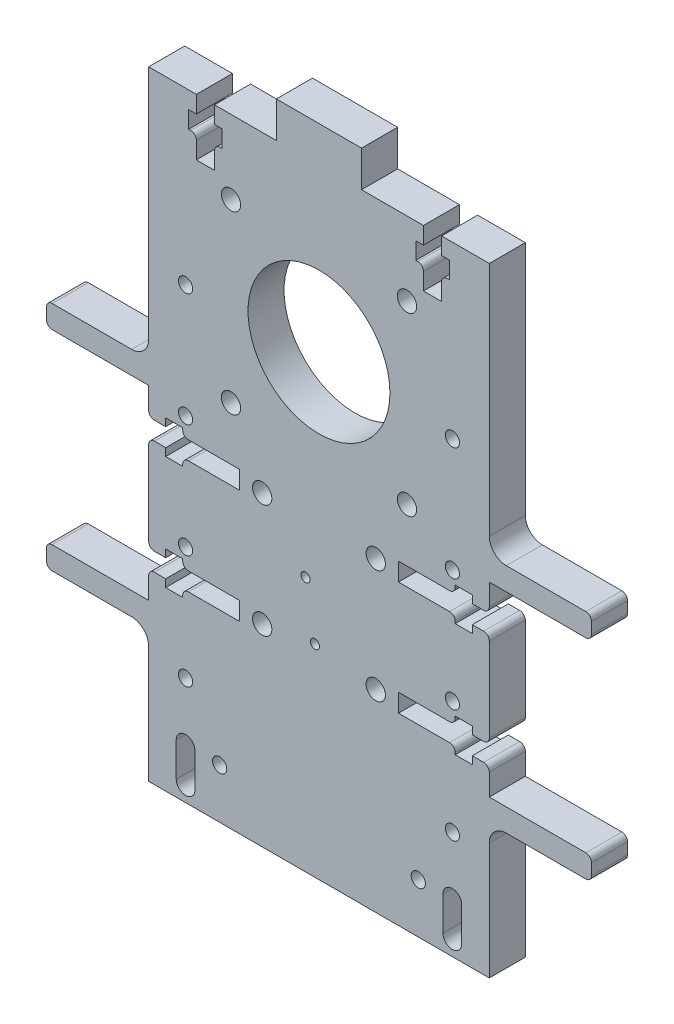
from build123d import *

# Parameters (mm, degrees)
BOSS_EXTRUDE1_DEPTH        = 6.35
FILLET1_R                  = 1
FILLET3_R                  = 3
M2_TAPPED_HOLE1_D          = 1.6
M2_TAPPED_HOLE2_D          = 1.6
M3_CLEARANCE_HOLE1_D       = 3.4
M3_CLEARANCE_HOLE2_D       = 3.4
M3_CLEARANCE_HOLE3_D       = 3.4
M3_CLEARANCE_HOLE4_D       = 3.4
M3_TAPPED_HOLE2_D          = 2.5
M3_TAPPED_HOLE3_D          = 2.5
M3_TAPPED_HOLE4_D          = 2.5
M3_TAPPED_HOLE5_D          = 2.5
M3_TAPPED_HOLE6_D          = 2.5
M3_TAPPED_HOLE7_D          = 2.5
M3_TAPPED_HOLE8_D          = 2.5
M3_TAPPED_HOLE9_D          = 2.5
M3_TAPPED_HOLE10_D         = 2.5
M3_CLEARANCE_HOLE8_D       = 3.4
M3_CLEARANCE_HOLE7_D       = 3.4
M3_TAPPED_HOLE1_D          = 2.5
M3_CLEARANCE_HOLE6_D       = 3.4
F_25_0_25_DIAMETER_HOLE1_D = 25
M3_CLEARANCE_HOLE5_D       = 3.4
FILLET4_R                  = 1


with BuildPart() as part:
    # Sketch1 → Boss-Extrude1 (new body)
    with BuildSketch(Plane.XY.offset(6.35)):
        Polygon((48, -56.9), (48, -52.9), (30, -52.9), (30, -48.1), (27, -48.1), (27, -49.45), (24, -49.45), (24, -48.1), (14, -48.1), (14, -44.9), (24, -44.9), (24, -43.55), (27, -43.55), (27, -44.9), (30, -44.9), (30, -28.1), (27, -28.1), (27, -29.45), (24, -29.45), (24, -28.1), (14, -28.1), (14, -24.9), (24, -24.9), (24, -23.55), (27, -23.55), (27, -24.9), (30, -24.9), (30, -20.1), (48, -20.1), (48, -16.1), (30, -16.1), (30, 28.5), (21.6, 28.5), (21.6, 25.5), (22.95, 25.5), (22.95, 22.5), (21.6, 22.5), (21.6, 18.5), (18.4, 18.5), (18.4, 22.5), (17.05, 22.5), (17.05, 25.5), (18.4, 25.5), (18.4, 28.5), (7.5, 28.5), (7.5, 34.85), (-7.5, 34.85), (-7.5, 28.5), (-18.4, 28.5), (-18.4, 25.5), (-17.05, 25.5), (-17.05, 22.5), (-18.4, 22.5), (-18.4, 18.5), (-21.6, 18.5), (-21.6, 22.5), (-22.95, 22.5), (-22.95, 25.5), (-21.6, 25.5), (-21.6, 28.5), (-30, 28.5), (-30, -16.1), (-48, -16.1), (-48, -20.1), (-30, -20.1), (-30, -24.9), (-27, -24.9), (-27, -23.55), (-24, -23.55), (-24, -24.9), (-14, -24.9), (-14, -28.1), (-24, -28.1), (-24, -29.45), (-27, -29.45), (-27, -28.1), (-30, -28.1), (-30, -44.9), (-27, -44.9), (-27, -43.55), (-24, -43.55), (-24, -44.9), (-14, -44.9), (-14, -48.1), (-24, -48.1), (-24, -49.45), (-27, -49.45), (-27, -48.1), (-30, -48.1), (-30, -52.9), (-48, -52.9), (-48, -56.9), (-30, -56.9), (-30, -80.5), (30, -80.5), (30, -56.9), align=None)
        with BuildLine():
            Line((-21.842448699, -71.75), (-21.842448699, -77.75))
            ThreePointArc((-21.842448699, -77.75), (-23.492448699, -79.4), (-25.142448699, -77.75))
            Line((-25.142448699, -77.75), (-25.142448699, -71.75))
            ThreePointArc((-25.142448699, -71.75), (-23.492448699, -70.1), (-21.842448699, -71.75))
        make_face(mode=Mode.SUBTRACT)
        with BuildLine():
            Line((21.842448699, -77.75), (21.842448699, -71.75))
            ThreePointArc((21.842448699, -71.75), (23.492448699, -70.1), (25.142448699, -71.75))
            Line((25.142448699, -71.75), (25.142448699, -77.75))
            ThreePointArc((25.142448699, -77.75), (23.492448699, -79.4), (21.842448699, -77.75))
        make_face(mode=Mode.SUBTRACT)
    extrude(amount=-BOSS_EXTRUDE1_DEPTH)

    # Fillet1
    fillet1_edges = [part.edges().sort_by_distance(p)[0] for p in [
        (-48, -16.1, 3.175),
        (48, -16.1, 3.175),
        (48, -56.9, 3.175),
        (30, -24.9, 3.175),
        (-30, -44.9, 3.175),
        (30, -28.1, 3.175),
        (-30, -24.9, 3.175),
        (30, -44.9, 3.175),
        (-30, -48.1, 3.175),
        (30, -48.1, 3.175),
        (-30, -28.1, 3.175),
        (-24, -48.1, 3.175),
        (-24, -44.9, 3.175),
        (-24, -28.1, 3.175),
        (-24, -24.9, 3.175),
        (24, -28.1, 3.175),
        (24, -24.9, 3.175),
        (24, -48.1, 3.175),
        (24, -44.9, 3.175),
        (48, -52.9, 3.175),
        (48, -20.1, 3.175),
        (-48, -56.9, 3.175),
        (-48, -52.9, 3.175),
        (-48, -20.1, 3.175),
    ]]
    fillet(fillet1_edges, radius=FILLET1_R)

    # Fillet3
    fillet3_edges = [part.edges().sort_by_distance(p)[0] for p in [
        (-30, -16.1, 3.175),
        (30, -16.1, 3.175),
        (-30, -56.9, 3.175),
        (30, -56.9, 3.175),
    ]]
    fillet(fillet3_edges, radius=FILLET3_R)

    # M2 Tapped Hole1 (through all)
    with Locations(Plane.XY.offset(6.35)):
        with Locations((-2.359287388, -35.545092005)):
            Hole(M2_TAPPED_HOLE1_D / 2)

    # M2 Tapped Hole2 (through all)
    with Locations(Plane.XY.offset(6.35)):
        with Locations((-0.7096297, -44.900765659)):
            Hole(M2_TAPPED_HOLE2_D / 2)

    # M3 Clearance Hole1 (through all)
    with Locations(Plane.XY.offset(6.35)):
        with Locations((15.5, 15.5)):
            Hole(M3_CLEARANCE_HOLE1_D / 2)

    # M3 Clearance Hole2 (through all)
    with Locations(Plane.XY.offset(6.35)):
        with Locations((-15.5, -15.5)):
            Hole(M3_CLEARANCE_HOLE2_D / 2)

    # M3 Clearance Hole3 (through all)
    with Locations(Plane.XY.offset(6.35)):
        with Locations((15.5, -15.5)):
            Hole(M3_CLEARANCE_HOLE3_D / 2)

    # M3 Clearance Hole4 (through all)
    with Locations(Plane.XY.offset(6.35)):
        with Locations((-15.5, 15.5)):
            Hole(M3_CLEARANCE_HOLE4_D / 2)

    # M3 Tapped Hole2 (through all)
    with Locations(Plane.XY.offset(6.35)):
        with Locations((23.5, -61.5)):
            Hole(M3_TAPPED_HOLE2_D / 2)

    # M3 Tapped Hole3 (through all)
    with Locations(Plane.XY.offset(6.35)):
        with Locations((23.5, -41.5)):
            Hole(M3_TAPPED_HOLE3_D / 2)

    # M3 Tapped Hole4 (through all)
    with Locations(Plane.XY.offset(6.35)):
        with Locations((23.5, -21.5)):
            Hole(M3_TAPPED_HOLE4_D / 2)

    # M3 Tapped Hole5 (through all)
    with Locations(Plane.XY.offset(6.35)):
        with Locations((23.5, -1.5)):
            Hole(M3_TAPPED_HOLE5_D / 2)

    # M3 Tapped Hole6 (through all)
    with Locations(Plane.XY.offset(6.35)):
        with Locations((-17.492448699, -71.75)):
            Hole(M3_TAPPED_HOLE6_D / 2)

    # M3 Tapped Hole7 (through all)
    with Locations(Plane.XY.offset(6.35)):
        with Locations((17.492448699, -71.75)):
            Hole(M3_TAPPED_HOLE7_D / 2)

    # M3 Tapped Hole8 (through all)
    with Locations(Plane.XY.offset(6.35)):
        with Locations((-23.5, -41.5)):
            Hole(M3_TAPPED_HOLE8_D / 2)

    # M3 Tapped Hole9 (through all)
    with Locations(Plane.XY.offset(6.35)):
        with Locations((-23.5, -61.5)):
            Hole(M3_TAPPED_HOLE9_D / 2)

    # M3 Tapped Hole10 (through all)
    with Locations(Plane.XY.offset(6.35)):
        with Locations((-23.5, -21.5)):
            Hole(M3_TAPPED_HOLE10_D / 2)

    # M3 Clearance Hole8 (through all)
    with Locations(Plane.XY.offset(6.35)):
        with Locations((-10, -46.5)):
            Hole(M3_CLEARANCE_HOLE8_D / 2)

    # M3 Clearance Hole7 (through all)
    with Locations(Plane.XY.offset(6.35)):
        with Locations((10, -46.5)):
            Hole(M3_CLEARANCE_HOLE7_D / 2)

    # M3 Tapped Hole1 (through all)
    with Locations(Plane.XY.offset(6.35)):
        with Locations((-23.5, -1.5)):
            Hole(M3_TAPPED_HOLE1_D / 2)

    # M3 Clearance Hole6 (through all)
    with Locations(Plane.XY.offset(6.35)):
        with Locations((10, -26.5)):
            Hole(M3_CLEARANCE_HOLE6_D / 2)

    # Ø25.0 (25) Diameter Hole1 (through all)
    with Locations(Plane.XY.offset(6.35)):
        with Locations((0, 0)):
            Hole(F_25_0_25_DIAMETER_HOLE1_D / 2)

    # M3 Clearance Hole5 (through all)
    with Locations(Plane.XY.offset(6.35)):
        with Locations((-10, -26.5)):
            Hole(M3_CLEARANCE_HOLE5_D / 2)

    # Fillet4
    fillet4_edges = [part.edges().sort_by_distance(p)[0] for p in [
        (21.6, 22.5, 3.175),
        (18.4, 22.5, 3.175),
        (-18.4, 22.5, 3.175),
        (-21.6, 22.5, 3.175),
    ]]
    fillet(fillet4_edges, radius=FILLET4_R)


solid = part.part
